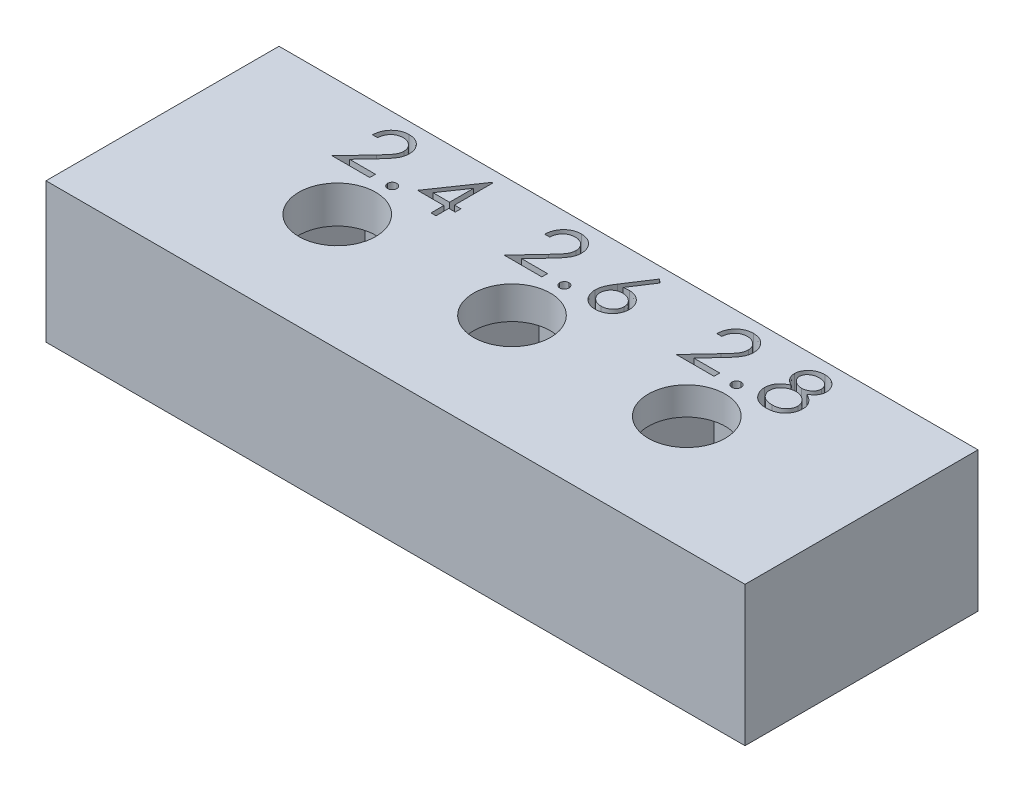
from build123d import *

# Parameters (mm, degrees)
SKETCH1_W           = 30
SKETCH1_H           = 10
SKETCH1_R           = 1.65
BOSS_EXTRUDE1_DEPTH = 6
CUT_EXTRUDE1_START  = 2
CUT_EXTRUDE1_DEPTH  = 2.4
CUT_EXTRUDE2_START  = 2
CUT_EXTRUDE2_DEPTH  = 2.6
CUT_EXTRUDE3_START  = 2
CUT_EXTRUDE3_DEPTH  = 2.8
CUT_EXTRUDE4_DEPTH  = 1


with BuildPart() as part:
    # Sketch1 → Boss-Extrude1 (new body)
    with BuildSketch(Plane(origin=(0, 0, 0), x_dir=(1, 0, 0), z_dir=(0, 1, 0))):
        with Locations((15, 5)):
            Rectangle(SKETCH1_W, SKETCH1_H)
        with Locations((7.5, 5)):
            Circle(SKETCH1_R, mode=Mode.SUBTRACT)
        with Locations((15, 5)):
            Circle(SKETCH1_R, mode=Mode.SUBTRACT)
        with Locations((22.5, 5)):
            Circle(SKETCH1_R, mode=Mode.SUBTRACT)
    extrude(amount=BOSS_EXTRUDE1_DEPTH)

    # Sketch2 → Cut-Extrude1 (cut)
    with BuildSketch(Plane(origin=(0, 0, 0), x_dir=(1, 0, 0), z_dir=(0, 1, 0)).offset(CUT_EXTRUDE1_START)):
        Polygon((10.733161507, 5), (9.116580754, 7.8), (5.883419246, 7.8), (4.266838493, 5), (5.883419246, 2.2), (9.116580754, 2.2), align=None)
    extrude(amount=CUT_EXTRUDE1_DEPTH, mode=Mode.SUBTRACT)

    # Sketch3 → Cut-Extrude2 (cut)
    with BuildSketch(Plane(origin=(0, 0, 0), x_dir=(1, 0, 0), z_dir=(0, 1, 0)).offset(CUT_EXTRUDE2_START)):
        Polygon((18.175426481, 5), (16.58771324, 7.75), (13.41228676, 7.75), (11.824573519, 5), (13.41228676, 2.25), (16.58771324, 2.25), align=None)
    extrude(amount=CUT_EXTRUDE2_DEPTH, mode=Mode.SUBTRACT)

    # Sketch4 → Cut-Extrude3 (cut)
    with BuildSketch(Plane(origin=(0, 0, 0), x_dir=(1, 0, 0), z_dir=(0, 1, 0)).offset(CUT_EXTRUDE3_START)):
        Polygon((25.675426481, 5), (24.08771324, 7.75), (20.91228676, 7.75), (19.324573519, 5), (20.91228676, 2.25), (24.08771324, 2.25), align=None)
    extrude(amount=CUT_EXTRUDE3_DEPTH, mode=Mode.SUBTRACT)

    # Sketch5 → Cut-Extrude4 (cut)
    # profile 1 of 9: a face of its own
    with BuildSketch(Plane(origin=(0, 6, 0), x_dir=(1, 0, 0), z_dir=(0, 1, 0))):
        with BuildLine():
            Line((5.513180713, 8.716214806), (5.29947879, 8.716214806))
            add(Edge.make_bspline(
                [(5.29947879, 8.716214806), (5.300871585, 8.744565892), (5.303606997, 8.800246671), (5.316416958, 8.881429543), (5.334746377, 8.95902754), (5.36066217, 9.032417606), (5.392847334, 9.102248652), (5.431444013, 9.168243305), (5.477159829, 9.23014981), (5.529007625, 9.287394274), (5.58531986, 9.339909389), (5.646079793, 9.385258759), (5.709927928, 9.423574889), (5.776670555, 9.455606948), (5.847060688, 9.479650665), (5.920459561, 9.497490745), (5.997189652, 9.508224294), (6.04946831, 9.509378034), (6.076056314, 9.509964806)],
                knots=[0, 0, 0, 0, 1.10065271, 2.161652631, 3.183658789, 4.190468796, 5.17591951, 6.163126047, 7.15150782, 8.156236427, 9.156009102, 10.134482811, 11.092018607, 12.041330605, 13.001268258, 13.972401359, 14.968799086, 16, 16, 16, 16], degree=3))
            add(Edge.make_bspline(
                [(6.076056314, 9.509964806), (6.10216711, 9.509353535), (6.153473893, 9.508152408), (6.228355371, 9.497837494), (6.299641352, 9.481682011), (6.367192493, 9.459015629), (6.430469833, 9.428546224), (6.489948726, 9.391944685), (6.546337278, 9.349612978), (6.597096536, 9.299774223), (6.643706497, 9.246568672), (6.683917138, 9.18976708), (6.718352166, 9.13110037), (6.747054855, 9.070121183), (6.768184121, 9.006255358), (6.784225723, 8.940432708), (6.793293124, 8.871971899), (6.794684743, 8.825635117), (6.795392251, 8.802077186)],
                knots=[0, 0, 0, 0, 1.111607364, 2.184268762, 3.212621178, 4.221274766, 5.211760367, 6.196651075, 7.1921475, 8.207485113, 9.220403448, 10.201281604, 11.166441695, 12.114753415, 13.065576456, 14.026450734, 14.996634279, 16, 16, 16, 16], degree=3))
            add(Edge.make_bspline(
                [(6.795392251, 8.802077186), (6.794240228, 8.768911248), (6.791956397, 8.703161389), (6.772420366, 8.606540562), (6.741908722, 8.512927897), (6.705171234, 8.437586982), (6.668110518, 8.376876337), (6.634713481, 8.326891379), (6.595616887, 8.273071409), (6.550251694, 8.215596649), (6.49955633, 8.154016908), (6.443071608, 8.088369387), (6.380394739, 8.019332343), (6.336403866, 7.972179782), (6.313608898, 7.947746507)],
                knots=[0, 0, 0, 0, 1.184426356, 2.348067706, 3.509069118, 4.696110526, 5.333549288, 6.050745305, 6.844228056, 7.710549037, 8.667450064, 9.695053472, 10.805634456, 12, 12, 12, 12], degree=3))
            Line((6.313608898, 7.947746507), (5.717819385, 7.311887883))
            Line((5.717819385, 7.311887883), (6.825921097, 7.311887883))
            Line((6.825921097, 7.311887883), (6.825921097, 7.067657114))
            Line((6.825921097, 7.067657114), (5.207892251, 7.067657114))
            Line((5.207892251, 7.067657114), (6.131389847, 8.053166428))
            add(Edge.make_bspline(
                [(6.131389847, 8.053166428), (6.153874213, 8.076637598), (6.197062078, 8.12172091), (6.258146296, 8.187540674), (6.313009607, 8.248602415), (6.362007155, 8.304790764), (6.404076022, 8.356927598), (6.441408737, 8.403324352), (6.471321041, 8.44601979), (6.503784551, 8.495509387), (6.535226564, 8.555933481), (6.562245149, 8.629775152), (6.578719894, 8.705789586), (6.580696219, 8.757157936), (6.581690328, 8.782996657)],
                knots=[0, 0, 0, 0, 1.329631726, 2.553950428, 3.673215718, 4.687767853, 5.603093632, 6.413772471, 7.123043292, 7.734684054, 8.834405432, 9.900288307, 10.943827018, 12, 12, 12, 12], degree=3))
            add(Edge.make_bspline(
                [(6.581690328, 8.782996657), (6.581257796, 8.799244537), (6.580405359, 8.831265988), (6.572882176, 8.878214549), (6.561513063, 8.923502396), (6.545221736, 8.967268831), (6.523717865, 9.00907382), (6.497542226, 9.048968248), (6.467341129, 9.08753699), (6.432403926, 9.123700216), (6.394023946, 9.156820822), (6.353478572, 9.186160602), (6.310581984, 9.210680068), (6.265515043, 9.230780198), (6.218403394, 9.246547734), (6.169155915, 9.257473303), (6.117908683, 9.264332993), (6.082915537, 9.265261117), (6.06508501, 9.265734037)],
                knots=[0, 0, 0, 0, 0.991446411, 1.95395049, 2.89581595, 3.838931463, 4.798493298, 5.75982156, 6.748411868, 7.785213223, 8.824556874, 9.840280684, 10.836137867, 11.835679398, 12.848801643, 13.863922112, 14.911575587, 16, 16, 16, 16], degree=3))
            add(Edge.make_bspline(
                [(6.06508501, 9.265734037), (6.046463068, 9.265247559), (6.009892649, 9.264292198), (5.956199522, 9.257609279), (5.904978305, 9.246080055), (5.856100153, 9.230311639), (5.809482364, 9.210269305), (5.765351648, 9.185305814), (5.723807075, 9.155517402), (5.684770548, 9.121744095), (5.648804162, 9.084142388), (5.617203698, 9.042225609), (5.589592074, 8.9967591), (5.565501149, 8.94786554), (5.54593701, 8.895101271), (5.53098742, 8.838653601), (5.519158155, 8.778767625), (5.515206287, 8.737412059), (5.513180713, 8.716214806)],
                knots=[0, 0, 0, 0, 1.031018746, 2.02475058, 2.990194455, 3.934040569, 4.864654155, 5.795059489, 6.735614925, 7.690564532, 8.649604399, 9.611025574, 10.590972636, 11.591080095, 12.624614302, 13.701020113, 14.821632451, 16, 16, 16, 16], degree=3))
        make_face()
    # profile 2 of 9: a face of its own
    with BuildSketch(Plane(origin=(0, 6, 0), x_dir=(1, 0, 0), z_dir=(0, 1, 0))):
        with BuildLine():
            add(Edge.make_bspline(
                [(7.622723982, 7.434003267), (7.635984287, 7.4332153), (7.661979565, 7.431670583), (7.6995619, 7.421072882), (7.733576124, 7.402255115), (7.763873955, 7.37717526), (7.788847468, 7.346766247), (7.808335858, 7.313023316), (7.818841243, 7.275126339), (7.820374708, 7.248980436), (7.821161482, 7.235565767)],
                knots=[0, 0, 0, 0, 1.020151414, 1.999887582, 2.974338812, 3.990962822, 5.007586832, 5.987933904, 6.967670073, 8, 8, 8, 8], degree=3))
            add(Edge.make_bspline(
                [(7.821161482, 7.235565767), (7.820348046, 7.222473431), (7.818743963, 7.196655535), (7.808359939, 7.159044397), (7.788698944, 7.125280378), (7.764046208, 7.094458744), (7.733568634, 7.069325759), (7.699481485, 7.050668091), (7.66206779, 7.039311583), (7.635999006, 7.037864942), (7.622723982, 7.037128267)],
                knots=[0, 0, 0, 0, 1.009421747, 1.99056486, 2.972319754, 3.999869655, 5.017953583, 5.993804169, 6.978383603, 8, 8, 8, 8], degree=3))
            add(Edge.make_bspline(
                [(7.622723982, 7.037128267), (7.609439392, 7.037838286), (7.583504394, 7.039224429), (7.546230352, 7.050901267), (7.511935611, 7.069150799), (7.481463971, 7.094505608), (7.456604761, 7.125121777), (7.437809634, 7.159276927), (7.426522408, 7.19654787), (7.425037955, 7.222452225), (7.424286482, 7.235565767)],
                knots=[0, 0, 0, 0, 1.022052826, 1.995314843, 2.982371812, 4.00089066, 5.028879526, 6.005146991, 6.990147033, 8, 8, 8, 8], degree=3))
            add(Edge.make_bspline(
                [(7.424286482, 7.235565767), (7.425009089, 7.249002399), (7.42641989, 7.275235773), (7.43783333, 7.31279088), (7.456458931, 7.346923336), (7.481635816, 7.377128866), (7.511928239, 7.402429513), (7.546147621, 7.420843239), (7.583594166, 7.431756448), (7.609454499, 7.433241339), (7.622723982, 7.434003267)],
                knots=[0, 0, 0, 0, 1.032775665, 2.016367738, 2.991239715, 4.008302682, 5.025365648, 6.011011707, 6.979408107, 8, 8, 8, 8], degree=3))
        make_face()
    # profile 3 of 9: a face of its own
    with BuildSketch(Plane(origin=(0, 6, 0), x_dir=(1, 0, 0), z_dir=(0, 1, 0))):
        Polygon((9.627801356, 9.509964806), (9.671209559, 9.509964806), (9.671209559, 7.861407114), (9.945969174, 7.861407114), (9.945969174, 7.617176344), (9.671209559, 7.617176344), (9.671209559, 7.067657114), (9.457507636, 7.067657114), (9.457507636, 7.617176344), (8.327940328, 7.617176344), align=None)
        Polygon((9.457507636, 7.861407114), (9.457507636, 8.895571777), (8.747711963, 7.861407114), align=None, mode=Mode.SUBTRACT)
    # profile 4 of 9: a face of its own
    with BuildSketch(Plane(origin=(0, 6, 0), x_dir=(1, 0, 0), z_dir=(0, 1, 0))):
        with BuildLine():
            Line((12.901161482, 8.716214806), (12.687459559, 8.716214806))
            add(Edge.make_bspline(
                [(12.687459559, 8.716214806), (12.688852354, 8.744565892), (12.691587767, 8.800246671), (12.704397728, 8.881429543), (12.722727146, 8.95902754), (12.748642939, 9.032417606), (12.780828103, 9.102248652), (12.819424782, 9.168243305), (12.865140598, 9.23014981), (12.916988394, 9.287394274), (12.973300629, 9.339909389), (13.034060563, 9.385258759), (13.097908697, 9.423574889), (13.164651324, 9.455606948), (13.235041458, 9.479650665), (13.30844033, 9.497490745), (13.385170421, 9.508224294), (13.437449079, 9.509378034), (13.464037083, 9.509964806)],
                knots=[0, 0, 0, 0, 1.10065271, 2.161652631, 3.183658789, 4.190468796, 5.17591951, 6.163126047, 7.15150782, 8.156236427, 9.156009102, 10.134482811, 11.092018607, 12.041330605, 13.001268258, 13.972401359, 14.968799086, 16, 16, 16, 16], degree=3))
            add(Edge.make_bspline(
                [(13.464037083, 9.509964806), (13.49014788, 9.509353535), (13.541454663, 9.508152408), (13.61633614, 9.497837494), (13.687622121, 9.481682011), (13.755173262, 9.459015629), (13.818450603, 9.428546224), (13.877929495, 9.391944685), (13.934318047, 9.349612978), (13.985077305, 9.299774223), (14.031687266, 9.246568672), (14.071897908, 9.18976708), (14.106332935, 9.13110037), (14.135035624, 9.070121183), (14.15616489, 9.006255358), (14.172206493, 8.940432708), (14.181273894, 8.871971899), (14.182665512, 8.825635117), (14.18337302, 8.802077186)],
                knots=[0, 0, 0, 0, 1.111607364, 2.184268762, 3.212621178, 4.221274766, 5.211760367, 6.196651075, 7.1921475, 8.207485113, 9.220403448, 10.201281604, 11.166441695, 12.114753415, 13.065576456, 14.026450734, 14.996634279, 16, 16, 16, 16], degree=3))
            add(Edge.make_bspline(
                [(14.18337302, 8.802077186), (14.182220997, 8.768911248), (14.179937166, 8.703161389), (14.160401135, 8.606540562), (14.129889491, 8.512927897), (14.093152003, 8.437586982), (14.056091287, 8.376876337), (14.022694251, 8.326891379), (13.983597656, 8.273071409), (13.938232464, 8.215596649), (13.887537099, 8.154016908), (13.831052377, 8.088369387), (13.768375508, 8.019332343), (13.724384635, 7.972179782), (13.701589667, 7.947746507)],
                knots=[0, 0, 0, 0, 1.184426356, 2.348067706, 3.509069118, 4.696110526, 5.333549288, 6.050745305, 6.844228056, 7.710549037, 8.667450064, 9.695053472, 10.805634456, 12, 12, 12, 12], degree=3))
            Line((13.701589667, 7.947746507), (13.105800154, 7.311887883))
            Line((13.105800154, 7.311887883), (14.213901866, 7.311887883))
            Line((14.213901866, 7.311887883), (14.213901866, 7.067657114))
            Line((14.213901866, 7.067657114), (12.59587302, 7.067657114))
            Line((12.59587302, 7.067657114), (13.519370616, 8.053166428))
            add(Edge.make_bspline(
                [(13.519370616, 8.053166428), (13.541854982, 8.076637598), (13.585042848, 8.12172091), (13.646127065, 8.187540674), (13.700990377, 8.248602415), (13.749987924, 8.304790764), (13.792056791, 8.356927598), (13.829389506, 8.403324352), (13.85930181, 8.44601979), (13.89176532, 8.495509387), (13.923207333, 8.555933481), (13.950225918, 8.629775152), (13.966700663, 8.705789586), (13.968676989, 8.757157936), (13.969671097, 8.782996657)],
                knots=[0, 0, 0, 0, 1.329631726, 2.553950428, 3.673215718, 4.687767853, 5.603093632, 6.413772471, 7.123043292, 7.734684054, 8.834405432, 9.900288307, 10.943827018, 12, 12, 12, 12], degree=3))
            add(Edge.make_bspline(
                [(13.969671097, 8.782996657), (13.969238565, 8.799244537), (13.968386128, 8.831265988), (13.960862945, 8.878214549), (13.949493833, 8.923502396), (13.933202505, 8.967268831), (13.911698634, 9.00907382), (13.885522995, 9.048968248), (13.855321898, 9.08753699), (13.820384695, 9.123700216), (13.782004715, 9.156820822), (13.741459342, 9.186160602), (13.698562753, 9.210680068), (13.653495813, 9.230780198), (13.606384163, 9.246547734), (13.557136684, 9.257473303), (13.505889452, 9.264332993), (13.470896306, 9.265261117), (13.453065779, 9.265734037)],
                knots=[0, 0, 0, 0, 0.991446411, 1.95395049, 2.89581595, 3.838931463, 4.798493298, 5.75982156, 6.748411868, 7.785213223, 8.824556874, 9.840280684, 10.836137867, 11.835679398, 12.848801643, 13.863922112, 14.911575587, 16, 16, 16, 16], degree=3))
            add(Edge.make_bspline(
                [(13.453065779, 9.265734037), (13.434443837, 9.265247559), (13.397873419, 9.264292198), (13.344180291, 9.257609279), (13.292959074, 9.246080055), (13.244080923, 9.230311639), (13.197463133, 9.210269305), (13.153332417, 9.185305814), (13.111787844, 9.155517402), (13.072751317, 9.121744095), (13.036784931, 9.084142388), (13.005184467, 9.042225609), (12.977572843, 8.9967591), (12.953481919, 8.94786554), (12.933917779, 8.895101271), (12.91896819, 8.838653601), (12.907138924, 8.778767625), (12.903187056, 8.737412059), (12.901161482, 8.716214806)],
                knots=[0, 0, 0, 0, 1.031018746, 2.02475058, 2.990194455, 3.934040569, 4.864654155, 5.795059489, 6.735614925, 7.690564532, 8.649604399, 9.611025574, 10.590972636, 11.591080095, 12.624614302, 13.701020113, 14.821632451, 16, 16, 16, 16], degree=3))
        make_face()
    # profile 5 of 9: a face of its own
    with BuildSketch(Plane(origin=(0, 6, 0), x_dir=(1, 0, 0), z_dir=(0, 1, 0))):
        with BuildLine():
            add(Edge.make_bspline(
                [(15.010704751, 7.434003267), (15.023965056, 7.4332153), (15.049960334, 7.431670583), (15.08754267, 7.421072882), (15.121556893, 7.402255115), (15.151854724, 7.37717526), (15.176828238, 7.346766247), (15.196316627, 7.313023316), (15.206822012, 7.275126339), (15.208355477, 7.248980436), (15.209142251, 7.235565767)],
                knots=[0, 0, 0, 0, 1.020151414, 1.999887582, 2.974338812, 3.990962822, 5.007586832, 5.987933904, 6.967670073, 8, 8, 8, 8], degree=3))
            add(Edge.make_bspline(
                [(15.209142251, 7.235565767), (15.208328816, 7.222473431), (15.206724733, 7.196655535), (15.196340708, 7.159044397), (15.176679713, 7.125280378), (15.152026977, 7.094458744), (15.121549404, 7.069325759), (15.087462254, 7.050668091), (15.050048559, 7.039311583), (15.023979775, 7.037864942), (15.010704751, 7.037128267)],
                knots=[0, 0, 0, 0, 1.009421747, 1.99056486, 2.972319754, 3.999869655, 5.017953583, 5.993804169, 6.978383603, 8, 8, 8, 8], degree=3))
            add(Edge.make_bspline(
                [(15.010704751, 7.037128267), (14.997420162, 7.037838286), (14.971485163, 7.039224429), (14.934211121, 7.050901267), (14.89991638, 7.069150799), (14.86944474, 7.094505608), (14.84458553, 7.125121777), (14.825790403, 7.159276927), (14.814503177, 7.19654787), (14.813018724, 7.222452225), (14.812267251, 7.235565767)],
                knots=[0, 0, 0, 0, 1.022052826, 1.995314843, 2.982371812, 4.00089066, 5.028879526, 6.005146991, 6.990147033, 8, 8, 8, 8], degree=3))
            add(Edge.make_bspline(
                [(14.812267251, 7.235565767), (14.812989858, 7.249002399), (14.814400659, 7.275235773), (14.825814099, 7.31279088), (14.844439701, 7.346923336), (14.869616585, 7.377128866), (14.899909008, 7.402429513), (14.934128391, 7.420843239), (14.971574935, 7.431756448), (14.997435268, 7.433241339), (15.010704751, 7.434003267)],
                knots=[0, 0, 0, 0, 1.032775665, 2.016367738, 2.991239715, 4.008302682, 5.025365648, 6.011011707, 6.979408107, 8, 8, 8, 8], degree=3))
        make_face()
    # profile 6 of 9: a face of its own
    with BuildSketch(Plane(origin=(0, 6, 0), x_dir=(1, 0, 0), z_dir=(0, 1, 0))):
        with BuildLine():
            Line((16.814959559, 9.509964806), (16.97952912, 9.380694223))
            Line((16.97952912, 9.380694223), (16.350348681, 8.418558556))
            add(Edge.make_bspline(
                [(16.350348681, 8.418558556), (16.392238459, 8.425235486), (16.473949207, 8.438259593), (16.556657434, 8.440408124), (16.596964517, 8.44145519)],
                knots=[0, 0, 0, 0, 1.025318673, 2, 2, 2, 2], degree=3))
            add(Edge.make_bspline(
                [(16.596964517, 8.44145519), (16.621166519, 8.440804693), (16.668807439, 8.439524208), (16.738752782, 8.429670017), (16.80596454, 8.414140789), (16.870164137, 8.391503772), (16.931582005, 8.362586992), (16.990570599, 8.327930367), (17.046021074, 8.28574436), (17.098647501, 8.238619452), (17.146427009, 8.186424504), (17.188728932, 8.131042523), (17.224261803, 8.07253121), (17.253091203, 8.010920199), (17.275478272, 7.946304463), (17.291798438, 7.878766676), (17.301445625, 7.808260264), (17.302755647, 7.760309934), (17.303421097, 7.735952636)],
                knots=[0, 0, 0, 0, 1.04369286, 2.054478336, 3.041073146, 4.015093852, 4.984733326, 5.965804835, 6.960378782, 7.985147595, 9.009457201, 10.008161701, 10.986880575, 11.956520048, 12.937015923, 13.931873656, 14.949455224, 16, 16, 16, 16], degree=3))
            add(Edge.make_bspline(
                [(17.303421097, 7.735952636), (17.302452878, 7.702628945), (17.300547651, 7.637055806), (17.281563104, 7.541549512), (17.25206306, 7.450563639), (17.209896206, 7.365550857), (17.157520691, 7.28662768), (17.093650401, 7.216696854), (17.020550456, 7.15432849), (16.937896045, 7.102174611), (16.848944136, 7.059582178), (16.755495723, 7.028989755), (16.658458325, 7.010155109), (16.592596619, 7.007793859), (16.559280472, 7.006599421)],
                knots=[0, 0, 0, 0, 1.031375318, 2.029502543, 3.004789286, 3.987476834, 4.960371455, 5.9300674, 6.912260825, 7.929083631, 8.949397511, 9.960523116, 10.96833055, 12, 12, 12, 12], degree=3))
            add(Edge.make_bspline(
                [(16.559280472, 7.006599421), (16.527237896, 7.007639147), (16.463767161, 7.009698661), (16.37039985, 7.02804513), (16.280685904, 7.057781569), (16.195253879, 7.098748784), (16.116114319, 7.150495308), (16.04531252, 7.212790359), (15.983201509, 7.284302334), (15.931511633, 7.365020142), (15.890514174, 7.451758845), (15.859768886, 7.542203589), (15.841810013, 7.636024826), (15.839300477, 7.699625387), (15.838036482, 7.731659517)],
                knots=[0, 0, 0, 0, 1.012016664, 2.004627821, 2.994792927, 3.992885782, 4.990978636, 5.973936114, 6.964471063, 7.975201453, 8.993600317, 9.990122807, 10.98767138, 12, 12, 12, 12], degree=3))
            add(Edge.make_bspline(
                [(15.838036482, 7.731659517), (15.838840286, 7.756182707), (15.840481502, 7.806254375), (15.851941023, 7.882089722), (15.870354749, 7.95968519), (15.890976542, 8.025512597), (15.912765394, 8.07943874), (15.93089864, 8.122915936), (15.953468805, 8.167656952), (15.977535338, 8.215195979), (16.005264565, 8.264307854), (16.035415033, 8.315813386), (16.068820331, 8.368893441), (16.092238335, 8.404914402), (16.104209859, 8.423328688)],
                knots=[0, 0, 0, 0, 1.173818275, 2.396712641, 3.66331629, 4.989737886, 5.693666774, 6.447286557, 7.243889047, 8.091586357, 8.998013824, 9.943181721, 10.948533338, 12, 12, 12, 12], degree=3))
            Line((16.104209859, 8.423328688), (16.814959559, 9.509964806))
        make_face()
        with BuildLine():
            add(Edge.make_bspline(
                [(16.552125274, 8.197224421), (16.533985425, 8.196695074), (16.498553031, 8.195661104), (16.446568701, 8.189656781), (16.397369864, 8.178349881), (16.350304707, 8.163949216), (16.306253144, 8.144148741), (16.264895023, 8.120096892), (16.226070407, 8.091779626), (16.190185955, 8.059598114), (16.157651506, 8.024363756), (16.129633629, 7.98662467), (16.105465711, 7.947290364), (16.085815759, 7.906032185), (16.070514475, 7.862865906), (16.059446254, 7.81799006), (16.05328647, 7.771103719), (16.052261695, 7.739308927), (16.051738405, 7.723073279)],
                knots=[0, 0, 0, 0, 1.129588631, 2.206414736, 3.251139165, 4.268635594, 5.265702196, 6.250456724, 7.242448911, 8.251968645, 9.246821453, 10.222880186, 11.173611482, 12.116736599, 13.062300278, 14.020270554, 14.989073742, 16, 16, 16, 16], degree=3))
            add(Edge.make_bspline(
                [(16.051738405, 7.723073279), (16.052164554, 7.706982847), (16.05300017, 7.675431903), (16.060587731, 7.628936854), (16.072177671, 7.584193229), (16.08941819, 7.541431695), (16.109983269, 7.50000045), (16.137133142, 7.461400193), (16.167216348, 7.423286539), (16.203175899, 7.388587323), (16.241768044, 7.35629987), (16.282998505, 7.328078483), (16.325969835, 7.303935212), (16.371262177, 7.285013733), (16.418232935, 7.269485066), (16.467273455, 7.258557524), (16.518417844, 7.252379523), (16.553062948, 7.251353413), (16.57072879, 7.25083019)],
                knots=[0, 0, 0, 0, 0.989467248, 1.94019797, 2.891935182, 3.827694429, 4.772920941, 5.730924762, 6.725747692, 7.756678648, 8.79901574, 9.819492441, 10.826891316, 11.826466727, 12.835195252, 13.867842842, 14.912794438, 16, 16, 16, 16], degree=3))
            add(Edge.make_bspline(
                [(16.57072879, 7.25083019), (16.588394602, 7.251353454), (16.623039649, 7.252379645), (16.67418445, 7.258557062), (16.723223449, 7.26948676), (16.770199734, 7.285007592), (16.815471672, 7.303957994), (16.85840542, 7.327928282), (16.899245962, 7.356473426), (16.937863442, 7.388532146), (16.973673318, 7.423484033), (17.004478038, 7.461059969), (17.030796452, 7.500312423), (17.052182926, 7.541268487), (17.069233554, 7.584219085), (17.080882267, 7.628929928), (17.088454158, 7.675433717), (17.089291927, 7.706983459), (17.089719174, 7.723073279)],
                knots=[0, 0, 0, 0, 1.087397944, 2.132534446, 3.165364764, 4.174271784, 5.174024072, 6.181601208, 7.194203697, 8.236725232, 9.267838612, 10.269026844, 11.221737037, 12.171628256, 13.107553087, 14.05945871, 15.010357665, 16, 16, 16, 16], degree=3))
            add(Edge.make_bspline(
                [(17.089719174, 7.723073279), (17.089344778, 7.739330108), (17.088609961, 7.771236975), (17.080298753, 7.817969087), (17.068771888, 7.863093914), (17.051366291, 7.906327855), (17.02875357, 7.947500298), (17.001210395, 7.986819227), (16.969347521, 8.024586088), (16.932541874, 8.059667213), (16.892475482, 8.091744064), (16.849874522, 8.120060227), (16.805305704, 8.143957755), (16.758814218, 8.163897052), (16.709867364, 8.178286247), (16.659255365, 8.1896164), (16.606330898, 8.195645737), (16.570423956, 8.196691491), (16.552125274, 8.197224421)],
                knots=[0, 0, 0, 0, 0.978206639, 1.919901502, 2.851605144, 3.780102724, 4.718870031, 5.675451981, 6.667674623, 7.690630536, 8.733308323, 9.756129687, 10.767539656, 11.776269907, 12.797430371, 13.836405707, 14.897401972, 16, 16, 16, 16], degree=3))
        make_face(mode=Mode.SUBTRACT)
    # profile 7 of 9: a face of its own
    with BuildSketch(Plane(origin=(0, 6, 0), x_dir=(1, 0, 0), z_dir=(0, 1, 0))):
        with BuildLine():
            Line((20.289142251, 8.716214806), (20.075440328, 8.716214806))
            add(Edge.make_bspline(
                [(20.075440328, 8.716214806), (20.076833123, 8.744565892), (20.079568536, 8.800246671), (20.092378497, 8.881429543), (20.110707915, 8.95902754), (20.136623708, 9.032417606), (20.168808872, 9.102248652), (20.207405551, 9.168243305), (20.253121367, 9.23014981), (20.304969163, 9.287394274), (20.361281398, 9.339909389), (20.422041332, 9.385258759), (20.485889467, 9.423574889), (20.552632093, 9.455606948), (20.623022227, 9.479650665), (20.6964211, 9.497490745), (20.773151191, 9.508224294), (20.825429849, 9.509378034), (20.852017852, 9.509964806)],
                knots=[0, 0, 0, 0, 1.10065271, 2.161652631, 3.183658789, 4.190468796, 5.17591951, 6.163126047, 7.15150782, 8.156236427, 9.156009102, 10.134482811, 11.092018607, 12.041330605, 13.001268258, 13.972401359, 14.968799086, 16, 16, 16, 16], degree=3))
            add(Edge.make_bspline(
                [(20.852017852, 9.509964806), (20.878128649, 9.509353535), (20.929435432, 9.508152408), (21.00431691, 9.497837494), (21.07560289, 9.481682011), (21.143154031, 9.459015629), (21.206431372, 9.428546224), (21.265910265, 9.391944685), (21.322298816, 9.349612978), (21.373058074, 9.299774223), (21.419668035, 9.246568672), (21.459878677, 9.18976708), (21.494313704, 9.13110037), (21.523016394, 9.070121183), (21.54414566, 9.006255358), (21.560187262, 8.940432708), (21.569254663, 8.871971899), (21.570646281, 8.825635117), (21.57135379, 8.802077186)],
                knots=[0, 0, 0, 0, 1.111607364, 2.184268762, 3.212621178, 4.221274766, 5.211760367, 6.196651075, 7.1921475, 8.207485113, 9.220403448, 10.201281604, 11.166441695, 12.114753415, 13.065576456, 14.026450734, 14.996634279, 16, 16, 16, 16], degree=3))
            add(Edge.make_bspline(
                [(21.57135379, 8.802077186), (21.570201766, 8.768911248), (21.567917936, 8.703161389), (21.548381904, 8.606540562), (21.51787026, 8.512927897), (21.481132773, 8.437586982), (21.444072056, 8.376876337), (21.41067502, 8.326891379), (21.371578425, 8.273071409), (21.326213233, 8.215596649), (21.275517868, 8.154016908), (21.219033146, 8.088369387), (21.156356277, 8.019332343), (21.112365404, 7.972179782), (21.089570436, 7.947746507)],
                knots=[0, 0, 0, 0, 1.184426356, 2.348067706, 3.509069118, 4.696110526, 5.333549288, 6.050745305, 6.844228056, 7.710549037, 8.667450064, 9.695053472, 10.805634456, 12, 12, 12, 12], degree=3))
            Line((21.089570436, 7.947746507), (20.493780923, 7.311887883))
            Line((20.493780923, 7.311887883), (21.601882636, 7.311887883))
            Line((21.601882636, 7.311887883), (21.601882636, 7.067657114))
            Line((21.601882636, 7.067657114), (19.98385379, 7.067657114))
            Line((19.98385379, 7.067657114), (20.907351386, 8.053166428))
            add(Edge.make_bspline(
                [(20.907351386, 8.053166428), (20.929835752, 8.076637598), (20.973023617, 8.12172091), (21.034107834, 8.187540674), (21.088971146, 8.248602415), (21.137968694, 8.304790764), (21.180037561, 8.356927598), (21.217370275, 8.403324352), (21.247282579, 8.44601979), (21.27974609, 8.495509387), (21.311188102, 8.555933481), (21.338206687, 8.629775152), (21.354681432, 8.705789586), (21.356657758, 8.757157936), (21.357651866, 8.782996657)],
                knots=[0, 0, 0, 0, 1.329631726, 2.553950428, 3.673215718, 4.687767853, 5.603093632, 6.413772471, 7.123043292, 7.734684054, 8.834405432, 9.900288307, 10.943827018, 12, 12, 12, 12], degree=3))
            add(Edge.make_bspline(
                [(21.357651866, 8.782996657), (21.357219335, 8.799244537), (21.356366898, 8.831265988), (21.348843714, 8.878214549), (21.337474602, 8.923502396), (21.321183275, 8.967268831), (21.299679403, 9.00907382), (21.273503764, 9.048968248), (21.243302668, 9.08753699), (21.208365465, 9.123700216), (21.169985484, 9.156820822), (21.129440111, 9.186160602), (21.086543522, 9.210680068), (21.041476582, 9.230780198), (20.994364932, 9.246547734), (20.945117454, 9.257473303), (20.893870221, 9.264332993), (20.858877075, 9.265261117), (20.841046548, 9.265734037)],
                knots=[0, 0, 0, 0, 0.991446411, 1.95395049, 2.89581595, 3.838931463, 4.798493298, 5.75982156, 6.748411868, 7.785213223, 8.824556874, 9.840280684, 10.836137867, 11.835679398, 12.848801643, 13.863922112, 14.911575587, 16, 16, 16, 16], degree=3))
            add(Edge.make_bspline(
                [(20.841046548, 9.265734037), (20.822424606, 9.265247559), (20.785854188, 9.264292198), (20.73216106, 9.257609279), (20.680939844, 9.246080055), (20.632061692, 9.230311639), (20.585443902, 9.210269305), (20.541313187, 9.185305814), (20.499768614, 9.155517402), (20.460732086, 9.121744095), (20.4247657, 9.084142388), (20.393165237, 9.042225609), (20.365553613, 8.9967591), (20.341462688, 8.94786554), (20.321898549, 8.895101271), (20.306948959, 8.838653601), (20.295119693, 8.778767625), (20.291167825, 8.737412059), (20.289142251, 8.716214806)],
                knots=[0, 0, 0, 0, 1.031018746, 2.02475058, 2.990194455, 3.934040569, 4.864654155, 5.795059489, 6.735614925, 7.690564532, 8.649604399, 9.611025574, 10.590972636, 11.591080095, 12.624614302, 13.701020113, 14.821632451, 16, 16, 16, 16], degree=3))
        make_face()
    # profile 8 of 9: a face of its own
    with BuildSketch(Plane(origin=(0, 6, 0), x_dir=(1, 0, 0), z_dir=(0, 1, 0))):
        with BuildLine():
            add(Edge.make_bspline(
                [(22.39868552, 7.434003267), (22.411945825, 7.4332153), (22.437941103, 7.431670583), (22.475523439, 7.421072882), (22.509537663, 7.402255115), (22.539835493, 7.37717526), (22.564809007, 7.346766247), (22.584297396, 7.313023316), (22.594802781, 7.275126339), (22.596336246, 7.248980436), (22.59712302, 7.235565767)],
                knots=[0, 0, 0, 0, 1.020151414, 1.999887582, 2.974338812, 3.990962822, 5.007586832, 5.987933904, 6.967670073, 8, 8, 8, 8], degree=3))
            add(Edge.make_bspline(
                [(22.59712302, 7.235565767), (22.596309585, 7.222473431), (22.594705502, 7.196655535), (22.584321477, 7.159044397), (22.564660483, 7.125280378), (22.540007746, 7.094458744), (22.509530173, 7.069325759), (22.475443024, 7.050668091), (22.438029328, 7.039311583), (22.411960544, 7.037864942), (22.39868552, 7.037128267)],
                knots=[0, 0, 0, 0, 1.009421747, 1.99056486, 2.972319754, 3.999869655, 5.017953583, 5.993804169, 6.978383603, 8, 8, 8, 8], degree=3))
            add(Edge.make_bspline(
                [(22.39868552, 7.037128267), (22.385400931, 7.037838286), (22.359465933, 7.039224429), (22.32219189, 7.050901267), (22.287897149, 7.069150799), (22.257425509, 7.094505608), (22.232566299, 7.125121777), (22.213771173, 7.159276927), (22.202483946, 7.19654787), (22.200999494, 7.222452225), (22.20024802, 7.235565767)],
                knots=[0, 0, 0, 0, 1.022052826, 1.995314843, 2.982371812, 4.00089066, 5.028879526, 6.005146991, 6.990147033, 8, 8, 8, 8], degree=3))
            add(Edge.make_bspline(
                [(22.20024802, 7.235565767), (22.200970627, 7.249002399), (22.202381428, 7.275235773), (22.213794869, 7.31279088), (22.23242047, 7.346923336), (22.257597355, 7.377128866), (22.287889777, 7.402429513), (22.32210916, 7.420843239), (22.359555704, 7.431756448), (22.385416037, 7.433241339), (22.39868552, 7.434003267)],
                knots=[0, 0, 0, 0, 1.032775665, 2.016367738, 2.991239715, 4.008302682, 5.025365648, 6.011011707, 6.979408107, 8, 8, 8, 8], degree=3))
        make_face()
    # profile 9 of 9: a face of its own
    with BuildSketch(Plane(origin=(0, 6, 0), x_dir=(1, 0, 0), z_dir=(0, 1, 0))):
        with BuildLine():
            add(Edge.make_bspline(
                [(24.261612954, 8.394230882), (24.281104198, 8.384067737), (24.319118633, 8.36424621), (24.373259555, 8.332330093), (24.422738529, 8.298692579), (24.468928357, 8.264922468), (24.51101753, 8.229726469), (24.548535425, 8.192964625), (24.582408788, 8.155554545), (24.611954511, 8.116862743), (24.637942001, 8.076992012), (24.660402043, 8.035837703), (24.679599819, 7.993490006), (24.694814604, 7.949486663), (24.707348001, 7.904474056), (24.71597194, 7.857870965), (24.720609879, 7.809984476), (24.721486732, 7.777621042), (24.721930713, 7.761234337)],
                knots=[0, 0, 0, 0, 1.272397273, 2.481599622, 3.635517121, 4.734568067, 5.792894095, 6.808321871, 7.773003508, 8.711915296, 9.623354172, 10.525449501, 11.423591555, 12.311487226, 13.218079475, 14.126165749, 15.051214107, 16, 16, 16, 16], degree=3))
            add(Edge.make_bspline(
                [(24.721930713, 7.761234337), (24.721405871, 7.738307844), (24.720367013, 7.692927712), (24.711318274, 7.625949197), (24.697770337, 7.560899038), (24.677985883, 7.497791497), (24.652327308, 7.436974798), (24.620706461, 7.378396883), (24.584912051, 7.321097674), (24.556165439, 7.285841974), (24.541619715, 7.268002666)],
                knots=[0, 0, 0, 0, 1.025265484, 2.029385089, 3.018602448, 3.995076438, 4.983346944, 5.966715145, 6.97116228, 8, 8, 8, 8], degree=3))
            add(Edge.make_bspline(
                [(24.541619715, 7.268002666), (24.522680971, 7.247187974), (24.485037514, 7.205815801), (24.420551272, 7.152101053), (24.34977924, 7.106959769), (24.272995268, 7.07017157), (24.190404604, 7.041538155), (24.102024847, 7.020962442), (24.007683701, 7.009177003), (23.942841942, 7.007473396), (23.909577197, 7.006599421)],
                knots=[0, 0, 0, 0, 0.954267603, 1.896743057, 2.838368354, 3.796610408, 4.779680527, 5.799409237, 6.871065594, 8, 8, 8, 8], degree=3))
            add(Edge.make_bspline(
                [(23.909577197, 7.006599421), (23.877591302, 7.007383518), (23.81535, 7.00890929), (23.724755087, 7.01924693), (23.64030707, 7.03736339), (23.561514931, 7.06215874), (23.488853677, 7.094414627), (23.422530352, 7.13456142), (23.361588061, 7.180983169), (23.307876263, 7.235013104), (23.26019109, 7.292882835), (23.218302825, 7.35258527), (23.183486176, 7.414125857), (23.154008277, 7.476586975), (23.131442176, 7.540844091), (23.115812868, 7.6065666), (23.105886924, 7.673639706), (23.104566259, 7.718904991), (23.103901866, 7.741676795)],
                knots=[0, 0, 0, 0, 1.256902934, 2.445805442, 3.576955095, 4.645999104, 5.686449165, 6.692658513, 7.68621702, 8.689161843, 9.678783111, 10.630372946, 11.551080876, 12.453998257, 13.34127905, 14.221779781, 15.105423033, 16, 16, 16, 16], degree=3))
            add(Edge.make_bspline(
                [(23.103901866, 7.741676795), (23.104295032, 7.758385817), (23.105072066, 7.791408741), (23.110450186, 7.840196695), (23.119096478, 7.887682994), (23.130839073, 7.934043036), (23.146753325, 7.978939308), (23.165968062, 8.022584541), (23.188373551, 8.065028009), (23.214282344, 8.106501819), (23.244423542, 8.146424844), (23.278552739, 8.185474619), (23.317352057, 8.223045211), (23.360389857, 8.259595646), (23.407174303, 8.2957743), (23.458920587, 8.329625965), (23.514256937, 8.363547188), (23.553585258, 8.383827495), (23.573759889, 8.394230882)],
                knots=[0, 0, 0, 0, 0.941657376, 1.861047343, 2.762797495, 3.66048619, 4.553285746, 5.444104102, 6.34607688, 7.256116206, 8.197091036, 9.162375105, 10.176350973, 11.237807142, 12.343728897, 13.50695164, 14.721116704, 16, 16, 16, 16], degree=3))
            add(Edge.make_bspline(
                [(23.573759889, 8.394230882), (23.546143258, 8.409290429), (23.492669729, 8.438449929), (23.421865341, 8.492025881), (23.361047792, 8.550052055), (23.311888779, 8.613753755), (23.273195352, 8.681141004), (23.246648766, 8.751792182), (23.228689729, 8.824397253), (23.226910713, 8.873999504), (23.226017251, 8.89891087)],
                knots=[0, 0, 0, 0, 1.166880483, 2.259407225, 3.286803203, 4.280235371, 5.237608625, 6.161067461, 7.076446754, 8, 8, 8, 8], degree=3))
            add(Edge.make_bspline(
                [(23.226017251, 8.89891087), (23.227129924, 8.92428653), (23.229366589, 8.975296032), (23.247452741, 9.051228056), (23.276925858, 9.125806469), (23.317013179, 9.198669802), (23.366942696, 9.267352001), (23.426845792, 9.328952181), (23.495291964, 9.382912314), (23.571939548, 9.428207889), (23.654423487, 9.465072128), (23.741451864, 9.490502805), (23.831508353, 9.507128092), (23.89280698, 9.509010405), (23.923887594, 9.509964806)],
                knots=[0, 0, 0, 0, 0.888701115, 1.786444228, 2.72001202, 3.692817113, 4.693886446, 5.687152267, 6.695133018, 7.739871481, 8.800368666, 9.853104506, 10.91144658, 12, 12, 12, 12], degree=3))
            add(Edge.make_bspline(
                [(23.923887594, 9.509964806), (23.954166082, 9.508980776), (24.013871812, 9.507040381), (24.101634228, 9.490856809), (24.185607225, 9.463826546), (24.265501223, 9.427157185), (24.33988594, 9.381990356), (24.405610011, 9.327289047), (24.463666643, 9.265960599), (24.51168924, 9.197299226), (24.551260777, 9.124715873), (24.578815855, 9.048772694), (24.596472465, 8.971110566), (24.598699522, 8.918561138), (24.599815328, 8.892232684)],
                knots=[0, 0, 0, 0, 1.072916533, 2.115669174, 3.151510826, 4.193348718, 5.225979165, 6.227137561, 7.216255879, 8.211077061, 9.189680878, 10.138522389, 11.067357538, 12, 12, 12, 12], degree=3))
            add(Edge.make_bspline(
                [(24.599815328, 8.892232684), (24.598839314, 8.86639499), (24.596922479, 8.815651226), (24.580798056, 8.741678362), (24.553642748, 8.67240301), (24.516567255, 8.607039091), (24.468244557, 8.546772036), (24.409319687, 8.490835474), (24.340262431, 8.438769899), (24.288377793, 8.409387748), (24.261612954, 8.394230882)],
                knots=[0, 0, 0, 0, 0.975232327, 1.915300861, 2.843280834, 3.77672583, 4.742871857, 5.749627742, 6.839139064, 8, 8, 8, 8], degree=3))
        make_face()
        with BuildLine():
            add(Edge.make_bspline(
                [(23.911962263, 9.265734037), (23.895258947, 9.265290824), (23.862579957, 9.264423707), (23.814663308, 9.259893456), (23.769098179, 9.251080643), (23.7254085, 9.239352162), (23.684193273, 9.223508013), (23.644892746, 9.204869623), (23.608175783, 9.182209603), (23.573599146, 9.156790645), (23.54247228, 9.128832793), (23.514846683, 9.099704174), (23.49189952, 9.068832702), (23.472413336, 9.0369863), (23.458274482, 9.003219783), (23.447685197, 8.968568393), (23.440526893, 8.932594248), (23.439990506, 8.908008515), (23.439719174, 8.895571777)],
                knots=[0, 0, 0, 0, 1.203892937, 2.355340988, 3.463153438, 4.544400666, 5.610487187, 6.640501085, 7.674077295, 8.714426146, 9.728707835, 10.68524104, 11.601827946, 12.495867327, 13.368432065, 14.231010473, 15.105153427, 16, 16, 16, 16], degree=3))
            add(Edge.make_bspline(
                [(23.439719174, 8.895571777), (23.440186829, 8.883134502), (23.441110983, 8.858556659), (23.448258221, 8.822262418), (23.458910474, 8.786596983), (23.475681728, 8.752408417), (23.495797411, 8.718510739), (23.520624648, 8.685751144), (23.550212718, 8.654015623), (23.583568887, 8.623574103), (23.619907809, 8.59506798), (23.658405167, 8.570321226), (23.698577801, 8.549615162), (23.740012959, 8.53238212), (23.783132938, 8.518985931), (23.827673521, 8.509482263), (23.873642193, 8.503575404), (23.904789338, 8.502869859), (23.920548501, 8.502512883)],
                knots=[0, 0, 0, 0, 0.873023192, 1.725219244, 2.590779336, 3.480155217, 4.391973325, 5.357036234, 6.360879153, 7.436073238, 8.526419356, 9.601555421, 10.645666583, 11.697338044, 12.750135903, 13.812665442, 14.89329948, 16, 16, 16, 16], degree=3))
            add(Edge.make_bspline(
                [(23.920548501, 8.502512883), (23.940789197, 8.503106744), (23.981070672, 8.504288601), (24.040451789, 8.515277168), (24.098188695, 8.532562265), (24.153664271, 8.556211457), (24.205442569, 8.585893983), (24.251598044, 8.62143109), (24.291737001, 8.662002213), (24.325442309, 8.70697575), (24.351574723, 8.754839955), (24.371918631, 8.802873369), (24.383798494, 8.851588458), (24.385348053, 8.884223124), (24.386113405, 8.900341909)],
                knots=[0, 0, 0, 0, 1.076279235, 2.141928126, 3.20205304, 4.278698113, 5.344010996, 6.36967002, 7.368914609, 8.37248503, 9.349703398, 10.264243087, 11.142681841, 12, 12, 12, 12], degree=3))
            add(Edge.make_bspline(
                [(24.386113405, 8.900341909), (24.385751525, 8.911654912), (24.385033244, 8.934109602), (24.379114099, 8.967269097), (24.369333398, 8.999674224), (24.356091553, 9.031592683), (24.338667746, 9.062576646), (24.318009254, 9.093113175), (24.29291462, 9.122515329), (24.264750261, 9.1514683), (24.232810617, 9.178263502), (24.197157241, 9.201827474), (24.157972921, 9.221838381), (24.115256732, 9.238091266), (24.069165989, 9.250298472), (24.01991298, 9.259439987), (23.967087026, 9.264592408), (23.930735713, 9.26534524), (23.911962263, 9.265734037)],
                knots=[0, 0, 0, 0, 0.814439003, 1.616544685, 2.417341072, 3.248991801, 4.09997495, 4.973547432, 5.9003056, 6.880240646, 7.880314356, 8.896779544, 9.951930927, 11.043077905, 12.18215768, 13.381699519, 14.647792085, 16, 16, 16, 16], degree=3))
        make_face(mode=Mode.SUBTRACT)
        with BuildLine():
            add(Edge.make_bspline(
                [(23.925795647, 8.258282114), (23.904618996, 8.25790544), (23.863075575, 8.257166497), (23.802212915, 8.248941319), (23.7438021, 8.237491322), (23.688040072, 8.220121233), (23.634950378, 8.197535764), (23.584245617, 8.170366015), (23.536313688, 8.138249454), (23.491816476, 8.101594114), (23.451183282, 8.06209295), (23.415533724, 8.020276747), (23.385259518, 7.976922667), (23.36088011, 7.931480096), (23.340869628, 7.884911276), (23.327729294, 7.836056465), (23.319305308, 7.785854876), (23.318174125, 7.751728094), (23.31760379, 7.734521597)],
                knots=[0, 0, 0, 0, 1.140299081, 2.23698856, 3.303958914, 4.344563908, 5.37730929, 6.408454204, 7.439741482, 8.480804886, 9.510774543, 10.48932336, 11.43758569, 12.353841022, 13.263987381, 14.161954604, 15.073269652, 16, 16, 16, 16], degree=3))
            add(Edge.make_bspline(
                [(23.31760379, 7.734521597), (23.318531292, 7.713137355), (23.320371436, 7.67071152), (23.334969614, 7.608007716), (23.358398076, 7.547305534), (23.391072375, 7.489099652), (23.431531563, 7.434705026), (23.481283678, 7.38729177), (23.537236819, 7.345163049), (23.60128418, 7.311090401), (23.671244262, 7.283879615), (23.747098456, 7.265131719), (23.827758142, 7.252721019), (23.8834519, 7.251470399), (23.911962263, 7.25083019)],
                knots=[0, 0, 0, 0, 0.898778495, 1.783155532, 2.693654817, 3.627872908, 4.583023416, 5.533784346, 6.509005473, 7.520592997, 8.575161974, 9.658835044, 10.801527049, 12, 12, 12, 12], degree=3))
            add(Edge.make_bspline(
                [(23.911962263, 7.25083019), (23.93424421, 7.251258005), (23.977656587, 7.252091524), (24.040988278, 7.259449107), (24.100753944, 7.271116976), (24.156837687, 7.288087496), (24.209867335, 7.308804355), (24.258943778, 7.33545536), (24.305329526, 7.365766852), (24.346738866, 7.401729276), (24.384453246, 7.440155504), (24.417337147, 7.480834086), (24.445883266, 7.522659472), (24.468288077, 7.566576855), (24.486199332, 7.611743667), (24.499074108, 7.658576399), (24.507018104, 7.707218691), (24.507821535, 7.74021538), (24.50822879, 7.756941218)],
                knots=[0, 0, 0, 0, 1.224942928, 2.386581632, 3.501229538, 4.569074225, 5.605009692, 6.626002462, 7.634866581, 8.645888296, 9.63523824, 10.59253846, 11.518950513, 12.414518923, 13.29783783, 14.186679152, 15.080837789, 16, 16, 16, 16], degree=3))
            add(Edge.make_bspline(
                [(24.50822879, 7.756941218), (24.507612489, 7.773186337), (24.506397252, 7.805218875), (24.498684253, 7.852685029), (24.485134344, 7.898543016), (24.466541954, 7.943344537), (24.441789906, 7.986181831), (24.412640093, 8.028170869), (24.37746963, 8.068146235), (24.337728203, 8.106418431), (24.294417375, 8.141807709), (24.248379549, 8.173113961), (24.199969103, 8.19947924), (24.149288475, 8.220921713), (24.096450201, 8.237786045), (24.041493142, 8.249567106), (23.984352957, 8.256982729), (23.945535268, 8.257844092), (23.925795647, 8.258282114)],
                knots=[0, 0, 0, 0, 0.917430815, 1.809013306, 2.70690318, 3.612392954, 4.541220862, 5.495268465, 6.494511384, 7.542276156, 8.608045339, 9.649016899, 10.681629292, 11.715607085, 12.752076957, 13.808767841, 14.885711793, 16, 16, 16, 16], degree=3))
        make_face(mode=Mode.SUBTRACT)
    extrude(amount=-CUT_EXTRUDE4_DEPTH, mode=Mode.SUBTRACT)


solid = part.part
